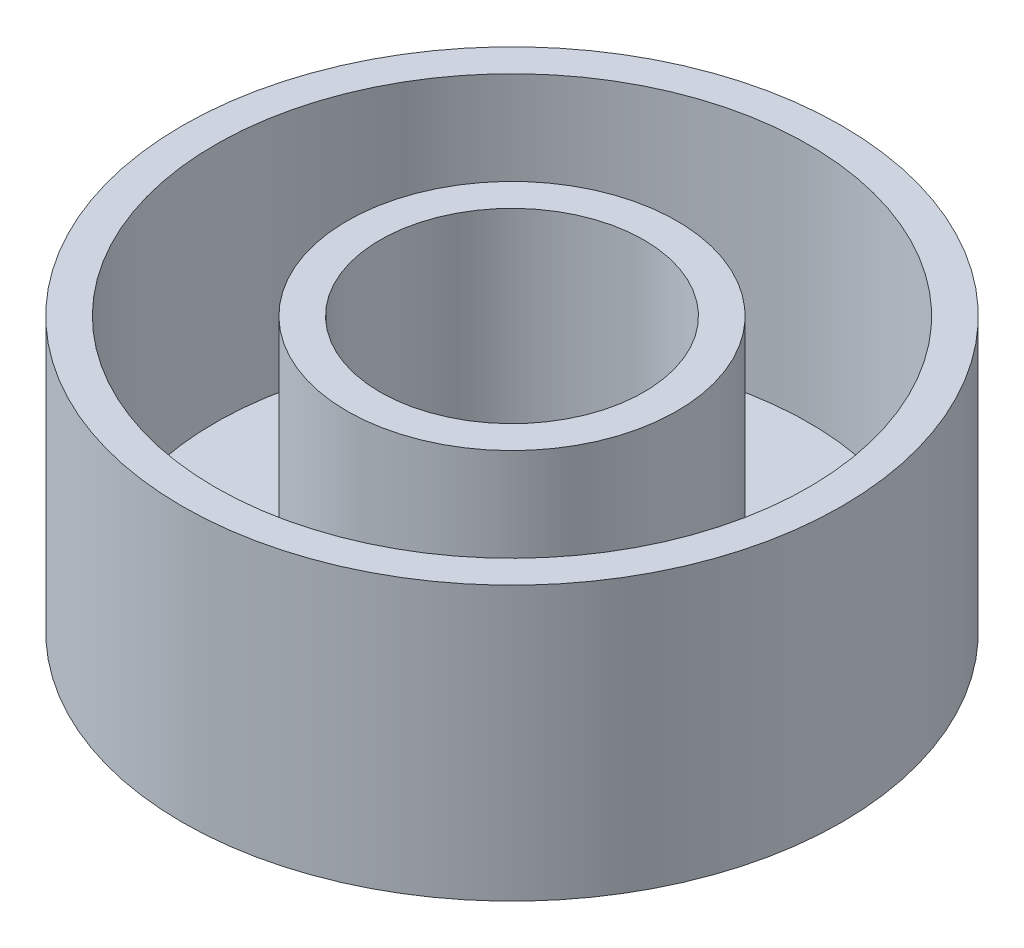
from build123d import *

# Parameters (mm, degrees)
SKETCH1_R            = 10
MAIN_EXTRUSION_DEPTH = 8.3
SKETCH2_R            = 4
ID_BORE_DEPTH        = 20
SKETCH3_R            = 9
SKETCH3_R_2          = 5
SEAL_RECESS_DEPTH    = 7.3


with BuildPart() as part:
    # Sketch1 → main extrusion (new body)
    with BuildSketch(Plane(origin=(0, 0, 0), x_dir=(1, 0, 0), z_dir=(0, 1, 0))):
        Circle(SKETCH1_R)
    extrude(amount=MAIN_EXTRUSION_DEPTH)

    # Sketch2 → ID bore (cut)
    with BuildSketch(Plane(origin=(0, 8.3, 0), x_dir=(1, 0, 0), z_dir=(0, 1, 0))):
        Circle(SKETCH2_R)
    extrude(amount=-ID_BORE_DEPTH, mode=Mode.SUBTRACT)

    # Sketch3 → seal recess (cut)
    with BuildSketch(Plane(origin=(0, 8.3, 0), x_dir=(1, 0, 0), z_dir=(0, 1, 0))):
        Circle(SKETCH3_R)
        Circle(SKETCH3_R_2, mode=Mode.SUBTRACT)
    extrude(amount=-SEAL_RECESS_DEPTH, mode=Mode.SUBTRACT)


solid = part.part
